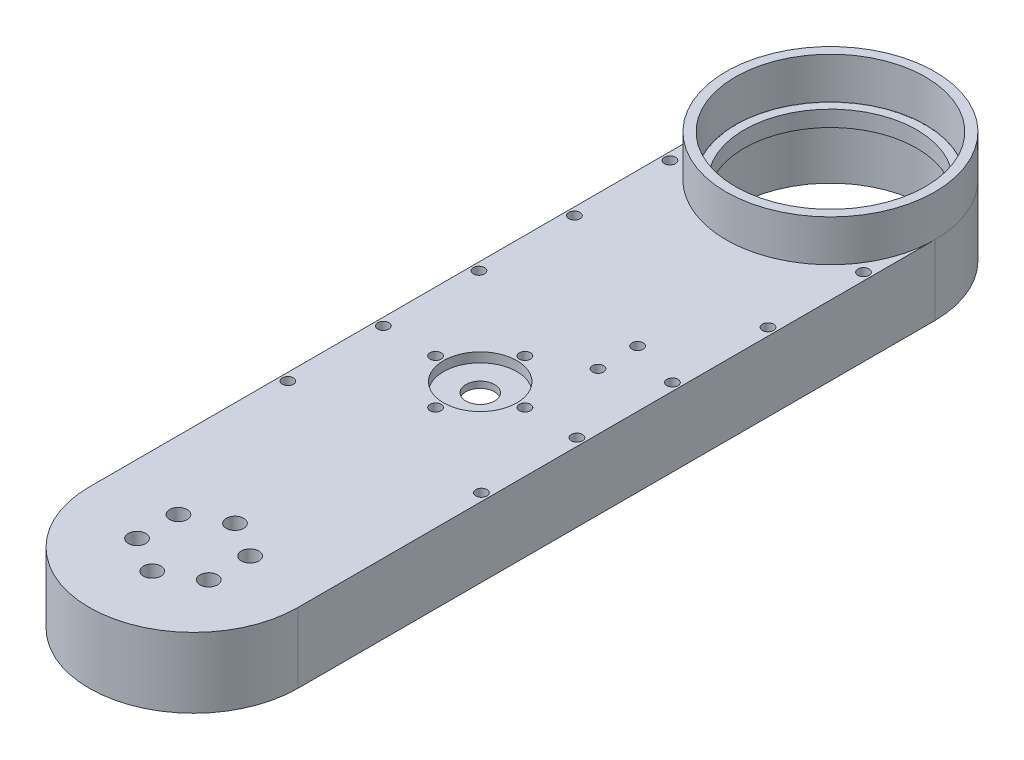
from build123d import *

# Parameters (mm, degrees)
SKETCH1_R               = 2.75
SKETCH1_R_2             = 1.25
SKETCH1_R_3             = 1.75
SKETCH1_R_4             = 4.5
BOSS_EXTRUDE10_DEPTH    = 5
BOSS_EXTRUDE9_DEPTH     = 22
SKETCH1_14_R            = 11.5
SKETCH1_14_R_2          = 4.5
CUT_EXTRUDE3_DEPTH      = 3
SKETCH1_16_R            = 1.25
BOSS_EXTRUDE11_DEPTH    = 5
BOSS_EXTRUDE12_DEPTH    = 22
SKETCH1_17_R            = 2.75
CUT_EXTRUDE4_DEPTH      = 55
CUT_EXTRUDE5_DEPTH      = 79
CUT_EXTRUDE5_DEPTH_BACK = 21
SKETCH3_R               = 1.75
CUT_EXTRUDE6_DEPTH      = 32
CUT_EXTRUDE6_DEPTH_BACK = 62
SKETCH7_R               = 29.72
SKETCH8_R               = 29.71398012
SKETCH8_R_2             = 27.095
BOSS_EXTRUDE13_DEPTH    = 5
SKETCH9_R               = 32.767980119
SKETCH9_R_2             = 29.85
BOSS_EXTRUDE14_DEPTH    = 13


with BuildPart() as part:
    # Sketch1 → Boss-Extrude10 (new body)
    with BuildSketch(Plane(origin=(0, 0, 0), x_dir=(1, 0, 0), z_dir=(0, 1, 0))):
        with BuildLine():
            Line((-32.774, 177.619546288), (-32.774, -22.380453712))
            ThreePointArc((-32.774, -22.380453712), (0, -55.154453712), (32.774, -22.380453712))
            Line((32.774, -22.380453712), (32.774, 177.619546288))
            ThreePointArc((32.774, 177.619546288), (0, 210.393546288), (-32.774, 177.619546288))
        make_face()
        with Locations((-11.258330249, -28.880453712)):
            Circle(SKETCH1_R, mode=Mode.SUBTRACT)
        with Locations((-11.258330249, -15.880453712)):
            Circle(SKETCH1_R, mode=Mode.SUBTRACT)
        with Locations((-6.733414, 27.619546288)):
            Circle(SKETCH1_R_2, mode=Mode.SUBTRACT)
        with Locations((-6.733414, 37.119546288)):
            Circle(SKETCH1_R_2, mode=Mode.SUBTRACT)
        with Locations((-14.032659813, 67.637846288)):
            Circle(SKETCH1_R_3, mode=Mode.SUBTRACT)
        with Locations((0, -35.380453712)):
            Circle(SKETCH1_R, mode=Mode.SUBTRACT)
        with Locations((11.258330249, -28.880453712)):
            Circle(SKETCH1_R, mode=Mode.SUBTRACT)
        with Locations((0, -9.380453712)):
            Circle(SKETCH1_R, mode=Mode.SUBTRACT)
        with Locations((11.258330249, -15.880453712)):
            Circle(SKETCH1_R, mode=Mode.SUBTRACT)
        with Locations((0, 53.605186475)):
            Circle(SKETCH1_R_3, mode=Mode.SUBTRACT)
        with Locations((14.032659813, 67.637846288)):
            Circle(SKETCH1_R_3, mode=Mode.SUBTRACT)
        with Locations((0, 81.6705061)):
            Circle(SKETCH1_R_3, mode=Mode.SUBTRACT)
        with Locations((15, 89.637846288)):
            Circle(SKETCH1_R_3, mode=Mode.SUBTRACT)
        with Locations((0, 177.619546288)):
            Circle(SKETCH1_R_4, mode=Mode.SUBTRACT)
        with Locations((0, 67.637846288)):
            Circle(SKETCH1_R_4, mode=Mode.SUBTRACT)
    extrude(amount=-BOSS_EXTRUDE10_DEPTH)

    # Sketch2 → Boss-Extrude9 (add)
    with BuildSketch(Plane.XZ):
        with BuildLine():
            ThreePointArc((32.774000001, 22.380453712), (0, 55.154453713), (-32.774000001, 22.380453712))
            Line((-32.774000001, 22.380453712), (-32.774000001, -177.619773144))
            ThreePointArc((-32.774000001, -177.619773144), (0, -210.393773145), (32.774000001, -177.619773144))
            Line((32.774000001, -177.619773144), (32.774000001, 22.380453712))
        make_face()
        with BuildLine():
            Line((28, -97.619319431), (28, -177.619773144))
            ThreePointArc((28, -177.619773144), (0, -205.619773144), (-28, -177.619773144))
            Line((-28, -177.619773144), (-28, -97.62))
            Line((-28, -97.62), (-28, -4.769011255))
            Line((-28, -4.769011255), (-28, 22.380453712))
            ThreePointArc((-28, 22.380453712), (0, 50.380453712), (28, 22.380453712))
            Line((28, 22.380453712), (28, -4.769011255))
            Line((28, -4.769011255), (28, -97.619319431))
        make_face(mode=Mode.SUBTRACT)
    extrude(amount=BOSS_EXTRUDE9_DEPTH)

    # Sketch1<14> → Cut-Extrude3 (cut)
    with BuildSketch(Plane(origin=(0, 0, 0), x_dir=(1, 0, 0), z_dir=(0, 1, 0))):
        with Locations((0, 67.637846288)):
            Circle(SKETCH1_14_R)
        with Locations((0, 67.637846288)):
            Circle(SKETCH1_14_R_2, mode=Mode.SUBTRACT)
    extrude(amount=-CUT_EXTRUDE3_DEPTH, mode=Mode.SUBTRACT)

    # Sketch1<16> → Boss-Extrude11 (add)
    with BuildSketch(Plane(origin=(0, 0, 0), x_dir=(1, 0, 0), z_dir=(0, 1, 0))):
        with Locations((-6.733414, 37.119546288)):
            Circle(SKETCH1_16_R)
        with Locations((-6.733414, 27.619546288)):
            Circle(SKETCH1_16_R)
    extrude(amount=-BOSS_EXTRUDE11_DEPTH)

    # Sketch2<13> → Boss-Extrude12 (add)
    with BuildSketch(Plane.XZ):
        with BuildLine():
            Line((-28, -4.769011255), (28, -4.769011255))
            Line((28, -4.769011255), (28, 22.380453712))
            ThreePointArc((28, 22.380453712), (0, 50.380453712), (-28, 22.380453712))
            Line((-28, 22.380453712), (-28, -4.769011255))
        make_face()
    extrude(amount=BOSS_EXTRUDE12_DEPTH)

    # Sketch1<17> → Cut-Extrude4 (cut)
    with BuildSketch(Plane(origin=(0, 0, 0), x_dir=(1, 0, 0), z_dir=(0, 1, 0))):
        with Locations((0, -9.380453712)):
            Circle(SKETCH1_17_R)
        with Locations((11.258330249, -15.880453712)):
            Circle(SKETCH1_17_R)
        with Locations((11.258330249, -28.880453712)):
            Circle(SKETCH1_17_R)
        with Locations((0, -35.380453712)):
            Circle(SKETCH1_17_R)
        with Locations((-11.258330249, -28.880453712)):
            Circle(SKETCH1_17_R)
        with Locations((-11.258330249, -15.880453712)):
            Circle(SKETCH1_17_R)
    extrude(amount=-CUT_EXTRUDE4_DEPTH, mode=Mode.SUBTRACT)

    # Sketch3 → Cut-Extrude5 (cut, two sides: drawn at the far end of the back side and taken through both)
    with BuildSketch(Plane.XZ.offset(5).offset(-CUT_EXTRUDE5_DEPTH_BACK)):
        with Locations((15, -89.637846288)):
            Circle(SKETCH3_R)
        with Locations((15, -102.056321071)):
            Circle(SKETCH3_R)
        with Locations((-30.389000001, -97.619546288)):
            Circle(SKETCH3_R)
        with Locations((30.389000001, -37.619546288)):
            Circle(SKETCH3_R)
        with Locations((-30.389000001, -37.619546288)):
            Circle(SKETCH3_R)
        with Locations((-30.389000001, -67.619546288)):
            Circle(SKETCH3_R)
        with Locations((-30.389000001, -127.619546288)):
            Circle(SKETCH3_R)
        with Locations((-30.389000001, -157.619546288)):
            Circle(SKETCH3_R)
        with Locations((30.389000001, -157.619546288)):
            Circle(SKETCH3_R)
        with Locations((30.389000001, -127.619546288)):
            Circle(SKETCH3_R)
        with Locations((30.389000001, -67.619546288)):
            Circle(SKETCH3_R)
        with Locations((30.389000001, -97.619546288)):
            Circle(SKETCH3_R)
    extrude(amount=CUT_EXTRUDE5_DEPTH + CUT_EXTRUDE5_DEPTH_BACK, mode=Mode.SUBTRACT)

    # Sketch7 → Cut-Extrude6 (cut, two sides: drawn at the far end of the back side and taken through both)
    with BuildSketch(Plane.XZ.offset(5).offset(-CUT_EXTRUDE6_DEPTH_BACK)):
        with Locations((0, -177.619773144)):
            Circle(SKETCH7_R)
    extrude(amount=CUT_EXTRUDE6_DEPTH + CUT_EXTRUDE6_DEPTH_BACK, mode=Mode.SUBTRACT)

    # Sketch9 → Boss-Extrude14 (add)
    with BuildSketch(Plane(origin=(0, 0, 0), x_dir=(1, 0, 0), z_dir=(0, 1, 0))):
        with Locations((0.006015604, 177.619546288)):
            Circle(SKETCH9_R)
        with Locations((0.006015604, 177.619546288)):
            Circle(SKETCH9_R_2, mode=Mode.SUBTRACT)
    extrude(amount=BOSS_EXTRUDE14_DEPTH)


with BuildPart() as body_2:
    # Sketch8 → Boss-Extrude13 (new body)
    with BuildSketch(Plane.XZ.offset(5)):
        with Locations((0.006015604, -177.619546288)):
            Circle(SKETCH8_R)
        with Locations((0.006015604, -177.619546288)):
            Circle(SKETCH8_R_2, mode=Mode.SUBTRACT)
    extrude(amount=-BOSS_EXTRUDE13_DEPTH)


solid = Compound([part.part, body_2.part])
